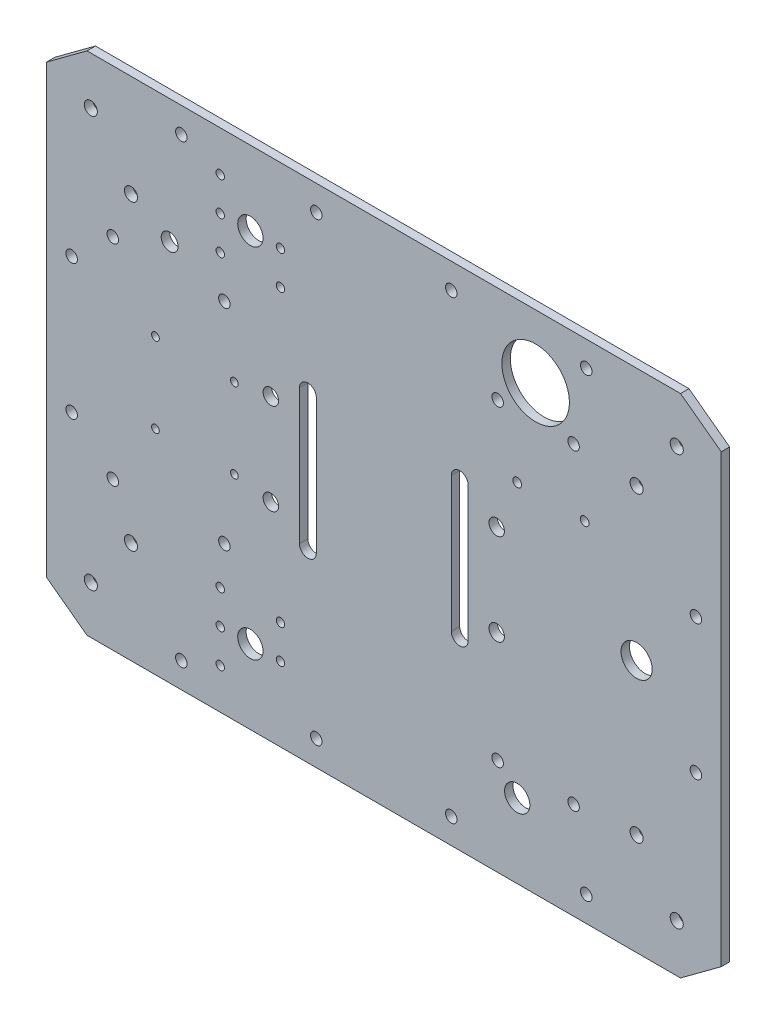
from build123d import *

# Parameters (mm, degrees)
SKETCH1_R                = 2.4638
SKETCH1_R_2              = 5.855
BOSS_EXTRUDE1_DEPTH      = 3.175
SKETCH2_R                = 2.159
CUT_EXTRUDE1_DEPTH       = 159.781746826
SKETCH5_R                = 12.7
SKETCH5_R_2              = 3.175
SKETCH5_R_3              = 2.159
SKETCH5_R_4              = 1.4478
CUT_EXTRUDE2_DEPTH       = 159.781746826
SKETCH6_R                = 2.159
CUT_EXTRUDE3_DEPTH       = 159.781746826
SKETCH5_3_R              = 2.9083
CUT_EXTRUDE4_DEPTH       = 159.781746826
SKETCH5_4_R              = 1.5875
SKETCH5_4_R_2            = 4.7625
CUT_EXTRUDE5_DEPTH       = 159.781746826
SKETCH5_5_R              = 1.5875
CUT_EXTRUDE6_DEPTH       = 2.54
SKETCH5_6_R              = 1.5875
CUT_EXTRUDE7_DEPTH       = 159.781746826
SKETCH5_7_R              = 1.651
CUT_EXTRUDE8_DEPTH       = 2.54
SKETCH5_9_R              = 1.651
CUT_EXTRUDE9_DEPTH       = 2.54
CUT_EXTRUDE13_DEPTH      = 159.781746826
CUT_EXTRUDE13_DEPTH_BACK = 159.781746826
SKETCH5_12_R             = 1.651
SKETCH5_13_R             = 1.5875
CUT_EXTRUDE14_DEPTH      = 159.781746826


with BuildPart() as part:
    # Sketch1 → Boss-Extrude1 (new body)
    with BuildSketch(Plane.XY):
        Polygon((-111.686526805, -95.25), (-127, -83.918625912), (-127, 83.918625912), (-111.686526805, 95.25), (111.686526805, 95.25), (127, 83.918625912), (127, -83.918625912), (111.686526805, -95.25), align=None)
        with Locations((-95.147512794, 56.885632681)):
            Circle(SKETCH1_R, mode=Mode.SUBTRACT)
        with Locations((-110.256011578, 77.303596941)):
            Circle(SKETCH1_R, mode=Mode.SUBTRACT)
        with Locations((110.256011578, 77.303596941)):
            Circle(SKETCH1_R, mode=Mode.SUBTRACT)
        with Locations((95.147512794, 56.885632681)):
            Circle(SKETCH1_R, mode=Mode.SUBTRACT)
        with Locations((-110.256011578, -77.303596941)):
            Circle(SKETCH1_R, mode=Mode.SUBTRACT)
        with Locations((-95.147512794, -56.885632681)):
            Circle(SKETCH1_R, mode=Mode.SUBTRACT)
        with Locations((110.256011578, -77.303596941)):
            Circle(SKETCH1_R, mode=Mode.SUBTRACT)
        with Locations((95.147512794, -56.885632681)):
            Circle(SKETCH1_R, mode=Mode.SUBTRACT)
        with Locations((95.147512794, 0)):
            Circle(SKETCH1_R_2, mode=Mode.SUBTRACT)
    extrude(amount=BOSS_EXTRUDE1_DEPTH)

    # Sketch2 → Cut-Extrude1 (cut, through all)
    with BuildSketch(Plane.XY.offset(3.175)):
        with Locations((42.8625, 58.7375)):
            Circle(SKETCH2_R)
        with Locations((42.8625, -58.7375)):
            Circle(SKETCH2_R)
        with Locations((71.4375, -58.7375)):
            Circle(SKETCH2_R)
        with Locations((71.4375, 58.7375)):
            Circle(SKETCH2_R)
    extrude(amount=-CUT_EXTRUDE1_DEPTH, mode=Mode.SUBTRACT)

    # Sketch5 → Cut-Extrude2 (cut, through all)
    with BuildSketch(Plane(origin=(0, 0, 0), x_dir=(-1, 0, 0), z_dir=(0, 0, -1))):
        with Locations((-57.15, 71.4375)):
            Circle(SKETCH5_R)
        with Locations((80.594630637, 48.58004)):
            Circle(SKETCH5_R_2)
        with Locations((59.995230637, -39.49954)):
            Circle(SKETCH5_R_3)
        with Locations((101.994130637, -39.49954)):
            Circle(SKETCH5_R_3)
        with Locations((101.994130637, 39.49954)):
            Circle(SKETCH5_R_3)
        with Locations((59.995230637, 39.49954)):
            Circle(SKETCH5_R_3)
        with BuildLine():
            Line((-31.75, 25.4), (-31.75, -25.4))
            ThreePointArc((-31.75, -25.4), (-28.575, -28.575), (-25.4, -25.4))
            Line((-25.4, -25.4), (-25.4, 25.4))
            ThreePointArc((-25.4, 25.4), (-28.575, 28.575), (-31.75, 25.4))
        make_face()
        with Locations((85.937708857, 15.03413)):
            Circle(SKETCH5_R_4)
        with Locations((56.219708857, 15.03413)):
            Circle(SKETCH5_R_4)
        with Locations((56.219708857, -15.03413)):
            Circle(SKETCH5_R_4)
        with Locations((85.937708857, -15.03413)):
            Circle(SKETCH5_R_4)
        with BuildLine():
            ThreePointArc((31.75, 25.4), (28.575, 28.575), (25.4, 25.4))
            Line((25.4, 25.4), (25.4, -25.4))
            ThreePointArc((25.4, -25.4), (28.575, -28.575), (31.75, -25.4))
            Line((31.75, -25.4), (31.75, 25.4))
        make_face()
    extrude(amount=-CUT_EXTRUDE2_DEPTH, mode=Mode.SUBTRACT)

    # Sketch6 → Cut-Extrude3 (cut, through all)
    with BuildSketch(Plane(origin=(0, 0, 0), x_dir=(-1, 0, 0), z_dir=(0, 0, -1))):
        with Locations((-76.2, -85.725)):
            Circle(SKETCH6_R)
        with Locations((-25.4, -85.725)):
            Circle(SKETCH6_R)
        with Locations((25.4, -85.725)):
            Circle(SKETCH6_R)
        with Locations((76.2, -85.725)):
            Circle(SKETCH6_R)
        with Locations((76.2, 85.725)):
            Circle(SKETCH6_R)
        with Locations((25.4, 85.725)):
            Circle(SKETCH6_R)
        with Locations((-25.4, 85.725)):
            Circle(SKETCH6_R)
        with Locations((-76.2, 85.725)):
            Circle(SKETCH6_R)
        with Locations((117.475, -25.4)):
            Circle(SKETCH6_R)
        with Locations((117.475, 25.4)):
            Circle(SKETCH6_R)
        with Locations((-117.475, 25.4)):
            Circle(SKETCH6_R)
        with Locations((-117.475, -25.4)):
            Circle(SKETCH6_R)
    extrude(amount=-CUT_EXTRUDE3_DEPTH, mode=Mode.SUBTRACT)

    # Sketch5<3> → Cut-Extrude4 (cut, through all)
    with BuildSketch(Plane(origin=(0, 0, 0), x_dir=(-1, 0, 0), z_dir=(0, 0, -1))):
        with Locations((-42.5, 17.2)):
            Circle(SKETCH5_3_R)
        with Locations((-42.5, -17.2)):
            Circle(SKETCH5_3_R)
        with Locations((42.5, -17.2)):
            Circle(SKETCH5_3_R)
        with Locations((42.5, 17.2)):
            Circle(SKETCH5_3_R)
    extrude(amount=-CUT_EXTRUDE4_DEPTH, mode=Mode.SUBTRACT)

    # Sketch5<4> → Cut-Extrude5 (cut, through all)
    with BuildSketch(Plane(origin=(0, 0, 0), x_dir=(-1, 0, 0), z_dir=(0, 0, -1))):
        with Locations((61.544630637, -54.61)):
            Circle(SKETCH5_4_R)
        with Locations((61.544630637, -67.31)):
            Circle(SKETCH5_4_R)
        with Locations((61.544630637, 54.61)):
            Circle(SKETCH5_4_R)
        with Locations((61.544630637, -80.01)):
            Circle(SKETCH5_4_R)
        with Locations((-50.215369363, -67.31)):
            Circle(SKETCH5_4_R_2)
        with Locations((50.215369363, -67.31)):
            Circle(SKETCH5_4_R_2)
        with Locations((61.544630637, 67.31)):
            Circle(SKETCH5_4_R)
        with Locations((61.544630637, 80.01)):
            Circle(SKETCH5_4_R)
        with Locations((50.215369363, 67.31)):
            Circle(SKETCH5_4_R_2)
    extrude(amount=-CUT_EXTRUDE5_DEPTH, mode=Mode.SUBTRACT)

    # Sketch5<5> → Cut-Extrude6 (cut)
    with BuildSketch(Plane(origin=(0, 0, 0), x_dir=(-1, 0, 0), z_dir=(0, 0, -1))):
        with Locations((38.886108088, 67.31)):
            Circle(SKETCH5_5_R)
        with Locations((38.886108088, 54.61)):
            Circle(SKETCH5_5_R)
        with Locations((38.886108088, -67.31)):
            Circle(SKETCH5_5_R)
    extrude(amount=-CUT_EXTRUDE6_DEPTH, mode=Mode.SUBTRACT)

    # Sketch5<6> → Cut-Extrude7 (cut, through all)
    with BuildSketch(Plane(origin=(0, 0, 0), x_dir=(-1, 0, 0), z_dir=(0, 0, -1))):
        with Locations((38.886108088, 67.31)):
            Circle(SKETCH5_6_R)
        with Locations((38.886108088, 54.61)):
            Circle(SKETCH5_6_R)
        with Locations((38.886108088, -67.31)):
            Circle(SKETCH5_6_R)
    extrude(amount=-CUT_EXTRUDE7_DEPTH, mode=Mode.SUBTRACT)

    # Sketch5<7> → Cut-Extrude8 (cut)
    with BuildSketch(Plane(origin=(0, 0, 0), x_dir=(-1, 0, 0), z_dir=(0, 0, -1))):
        with Locations((-50.215369363, 35.56)):
            Circle(SKETCH5_7_R)
    extrude(amount=-CUT_EXTRUDE8_DEPTH, mode=Mode.SUBTRACT)

    # Sketch5<9> → Cut-Extrude9 (cut)
    with BuildSketch(Plane(origin=(0, 0, 0), x_dir=(-1, 0, 0), z_dir=(0, 0, -1))):
        with Locations((-50.215369363, 35.56)):
            Circle(SKETCH5_9_R)
        with Locations((-75.615369363, 35.627632966)):
            Circle(SKETCH5_9_R)
    extrude(amount=-CUT_EXTRUDE9_DEPTH, mode=Mode.SUBTRACT)

    # Sketch5<12> → Cut-Extrude13 (cut, two sides: drawn at the far end of the back side and taken through both)
    with BuildSketch(Plane(origin=(0, 0, 0), x_dir=(-1, 0, 0), z_dir=(0, 0, -1)).offset(-CUT_EXTRUDE13_DEPTH_BACK)):
        with Locations((-50.215369363, 35.56)):
            Circle(SKETCH5_12_R)
        with Locations((-75.615369363, 35.627632966)):
            Circle(SKETCH5_12_R)
    extrude(amount=CUT_EXTRUDE13_DEPTH + CUT_EXTRUDE13_DEPTH_BACK, mode=Mode.SUBTRACT)

    # Sketch5<13> → Cut-Extrude14 (cut, through all)
    with BuildSketch(Plane(origin=(0, 0, 0), x_dir=(-1, 0, 0), z_dir=(0, 0, -1))):
        with Locations((38.886108088, -54.61)):
            Circle(SKETCH5_13_R)
    extrude(amount=-CUT_EXTRUDE14_DEPTH, mode=Mode.SUBTRACT)


solid = part.part
